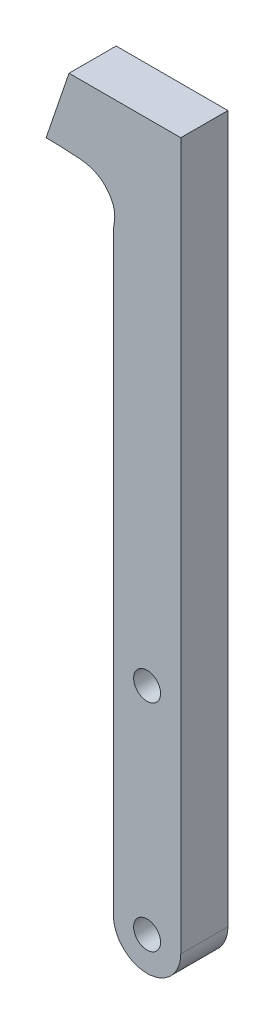
from build123d import *

# Parameters (mm, degrees)
BOSS_EXTRU_1_DEPTH      = 3.5
ESQUISSE3_R             = 1
ENL_V_MAT_EXTRU_1_DEPTH = 4
ESQUISSE4_R             = 1
ENL_V_MAT_EXTRU_2_DEPTH = 10
ENL_V_MAT_EXTRU_3_DEPTH = 57.011159602
CONG_1_SIZE             = 5
CONG_1_SIZE_2           = 3
ENL_V_MAT_EXTRU_7_DEPTH = 6
CONG_4_R                = 2
CONG_5_R                = 2


with BuildPart() as part:
    # Esquisse1 → Boss.-Extru.1 (new body)
    with BuildSketch(Plane.XY):
        with BuildLine():
            Line((0, 0), (10, 0))
            Line((10, 0), (10, -52.5))
            ThreePointArc((10, -52.5), (7.5, -55), (5, -52.5))
            Line((5, -52.5), (5, -5))
            Line((5, -5), (0, -5))
            Line((0, -5), (0, 0))
        make_face()
    extrude(amount=BOSS_EXTRU_1_DEPTH)

    # Esquisse3 → Enlèv. mat.-Extru.1 (cut)
    with BuildSketch(Plane(origin=(0, 0, 0), x_dir=(-1, 0, 0), z_dir=(0, 0, -1))):
        with Locations((-7.5, -52.5)):
            Circle(ESQUISSE3_R)
    extrude(amount=-ENL_V_MAT_EXTRU_1_DEPTH, mode=Mode.SUBTRACT)

    # Esquisse4 → Enlèv. mat.-Extru.2 (cut)
    with BuildSketch(Plane.XY.offset(3.5)):
        with Locations((7.5, -36.5)):
            Circle(ESQUISSE4_R)
    extrude(amount=-ENL_V_MAT_EXTRU_2_DEPTH, mode=Mode.SUBTRACT)

    # Esquisse5 → Enlèv. mat.-Extru.3 (cut, through all)
    with BuildSketch(Plane.XY.offset(3.5)):
        Polygon((0, 0), (1.700931961, 0), (0, -5), align=None)
    extrude(amount=-ENL_V_MAT_EXTRU_3_DEPTH, mode=Mode.SUBTRACT)

    # Congé1
    # a fillet whose section is not a circle: 5, 3 mm, written as the material it adds along each edge
    with BuildSketch(Plane(origin=(5, -5, 0), x_dir=(-1, 0, 0), z_dir=(0, 0, 1))) as cong_1_piece_1_section:
        with BuildLine():
            Bezier((CONG_1_SIZE, 0), (0, 0), (0, CONG_1_SIZE_2), weights=[1, 1.5, 1])
            Line((0, CONG_1_SIZE_2), (0, 0))
            Line((0, 0), (CONG_1_SIZE, 0))
        make_face()
    cong_1_piece_1 = extrude(amount=3.5, mode=Mode.PRIVATE)
    cong_1_piece_1 = split(cong_1_piece_1, bisect_by=Plane(origin=(0.518616131, -3.47549419, 0), z_dir=(0.9467189518296611, -0.32206090456084224, 0)), keep=Keep.TOP, mode=Mode.PRIVATE)
    add(cong_1_piece_1)

    # Esquisse11 → Enlèv. mat.-Extru.7 (cut)
    with BuildSketch(Plane.XY.offset(3.5)):
        with BuildLine():
            Line((5.143373152, -7.30566223), (4.982244072, -8.50993083))
            Line((4.982244072, -8.50993083), (2.030783729, -5.080870965))
            add(Edge.make_bspline(
                [(2.030783729, -5.080870965), (4.543708127, -5.064842627), (5.143373152, -7.30566223)],
                knots=[0, 0, 0, 1, 1, 1], degree=2))
        make_face()
    extrude(amount=-ENL_V_MAT_EXTRU_7_DEPTH, mode=Mode.SUBTRACT)

    # Congé4
    cong_4_edges = [part.edges().sort_by_distance(p)[0] for p in [
        (5, -8.377224145, 1.75),
        (5.143373152, -7.30566223, 1.75),
    ]]
    fillet(cong_4_edges, radius=CONG_4_R)

    # Congé5
    cong_5_edges = [part.edges().sort_by_distance(p)[0] for p in [
        (2.032105754, -5.080862688, 1.75),
    ]]
    fillet(cong_5_edges, radius=CONG_5_R)


solid = part.part
